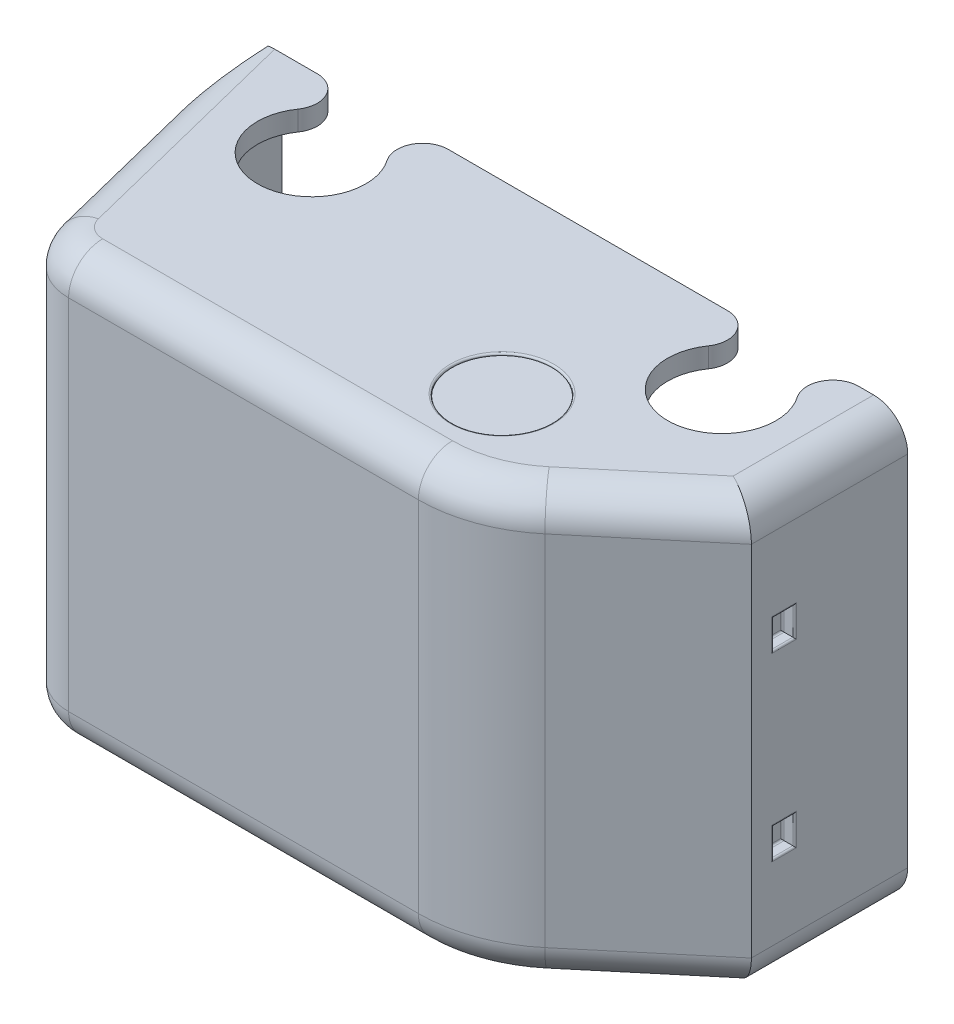
from build123d import *

# Parameters (mm, degrees)
BOSS_EXTRUDE1_DEPTH      = 70
BOSS_EXTRUDE1_DEPTH_BACK = 30
SKETCH1_W                = 225
SKETCH1_H                = 150
CUT_EXTRUDE1_DEPTH       = 280.329554469
CUT_EXTRUDE2_DEPTH       = 68
CUT_EXTRUDE2_DEPTH_BACK  = 68
SKETCH8_R                = 19.05
CUT_EXTRUDE3_DEPTH       = 185
FILLET1_R                = 12
FILLET2_R                = 50.8
FILLET3_R                = 19.05
SKETCH13_W               = 7.4
SKETCH13_H               = 9.9
CUT_EXTRUDE4_DEPTH       = 4.318
FILLET4_R                = 0.635
FILLET4_OF_MIRROR2_R     = 0.635
SKETCH14_R               = 17.5254
CUT_EXTRUDE5_DEPTH       = 0.75
FILLET5_R                = 0.635
FILLET6_R                = 0.635
SKETCH16_W               = 15.1
SKETCH16_H               = 10.1
CUT_EXTRUDE6_DEPTH       = 3.05


with BuildPart() as part:
    # Sketch1 → Boss-Extrude1 (new, two sides: drawn at the far end of the back side and taken through both)
    with BuildSketch(Plane.XY.offset(-BOSS_EXTRUDE1_DEPTH_BACK)):
        with Locations((112.5, 75)):
            Rectangle(SKETCH1_W, SKETCH1_H)
    extrude(amount=BOSS_EXTRUDE1_DEPTH + BOSS_EXTRUDE1_DEPTH_BACK)

    # Sketch2 → Cut-Extrude1 (cut, through all)
    with BuildSketch(Plane.XZ):
        Polygon((225, 70), (171.371088333, 70), (225, 25), align=None)
        Polygon((0, 70), (15, 70), (0, 10), align=None)
    extrude(amount=-CUT_EXTRUDE1_DEPTH, mode=Mode.SUBTRACT)

    # Sketch7 → Cut-Extrude2 (cut, two sides: drawn at the far end of the back side and taken through both)
    with BuildSketch(Plane(origin=(0, 75, 0), x_dir=(1, 0, 0), z_dir=(0, 1, 0)).offset(-CUT_EXTRUDE2_DEPTH_BACK)):
        Polygon((215, 30.615528128), (215, -26.863959865), (169.551237162, -65), (18.903882032, -65), (5, -9.384471872), (5, 30.615528128), align=None)
    extrude(amount=CUT_EXTRUDE2_DEPTH + CUT_EXTRUDE2_DEPTH_BACK, mode=Mode.SUBTRACT)

    # Sketch8 → Cut-Extrude3 (cut)
    with BuildSketch(Plane.XZ):
        with Locations((40.375, -5)):
            Circle(SKETCH8_R)
        with BuildLine():
            Line((17.33584854, -30), (63.41415146, -30))
            ThreePointArc((63.41415146, -30), (55.439090064, -25.17113842), (56.02191035, -15.86631016))
            ThreePointArc((56.02191035, -15.86631016), (40.375, -24.05), (24.72808965, -15.86631016))
            ThreePointArc((24.72808965, -15.86631016), (25.310909936, -25.17113842), (17.33584854, -30))
        make_face()
        with Locations((184.625, -5)):
            Circle(SKETCH8_R)
        with BuildLine():
            ThreePointArc((200.27191035, -15.86631016), (184.625, -24.05), (168.97808965, -15.86631016))
            ThreePointArc((168.97808965, -15.86631016), (169.560909936, -25.17113842), (161.58584854, -30))
            Line((161.58584854, -30), (207.66415146, -30))
            ThreePointArc((207.66415146, -30), (199.689090064, -25.17113842), (200.27191035, -15.86631016))
        make_face()
    extrude(amount=-CUT_EXTRUDE3_DEPTH, mode=Mode.SUBTRACT)

    # Fillet1
    fillet1_edges = [part.edges().sort_by_distance(p)[0] for p in [
        (198.185544167, 0, 47.5),
        (225, 0, -2.5),
        (7.5, 0, 40),
        (93.185544167, 0, 70),
        (7.5, 150, 40),
        (93.185544167, 150, 70),
        (198.185544167, 150, 47.5),
        (225, 150, -2.5),
    ]]
    fillet(fillet1_edges, radius=FILLET1_R)

    # Fillet2
    # the kernel refuses this fillet: 50.8 mm, written as the material it takes off along each edge
    with BuildSketch(Plane(origin=(152.881400433, 150, 19.2), x_dir=(0, 0, 1), z_dir=(-1, 0, 0))) as fillet2_piece_1:
        with BuildLine():
            CenterArc((38.8, -12), 12, 0, 90)
            Line((50.8, -12), (50.8, 0))
            Line((50.8, 0), (38.8, 0))
        make_face()
    revolve(axis=Axis((152.881400433, 150, 19.2), (0, 1, 0)), revolution_arc=40, mode=Mode.SUBTRACT)
    with BuildSketch(Plane(origin=(152.881400433, 0, 19.2), x_dir=(0.6427876096865435, 0, 0.7660444431189747), z_dir=(0.7660444431189747, 0, -0.6427876096865435))) as fillet2_piece_2:
        with BuildLine():
            CenterArc((38.8, -12), 12, 0, 90)
            Line((50.8, -12), (50.8, 0))
            Line((50.8, 0), (38.8, 0))
        make_face()
    revolve(axis=Axis((152.881400433, 0, 19.2), (0, -1, 0)), revolution_arc=40, mode=Mode.SUBTRACT)
    with BuildSketch(Plane(origin=(171.371088333, 0, 70), x_dir=(-1, 0, 0), z_dir=(0, 1, 0))) as fillet2_piece_3:
        with BuildLine():
            CenterArc((FILLET2_R * 0.363970234266, -FILLET2_R), FILLET2_R, 90, 40)
            Line((-FILLET2_R * 0.27881737542, -FILLET2_R * 0.233955556881), (0, 0))
            Line((0, 0), (FILLET2_R * 0.363970234266, 0))
        make_face()
    extrude(amount=150, mode=Mode.SUBTRACT)

    # Fillet3
    # the kernel refuses this fillet: 19.05 mm, written as the material it takes off along each edge
    with BuildSketch(Plane(origin=(29.873790542, 150, 50.95), x_dir=(-0.9701425001453319, 0, 0.24253562503633305), z_dir=(-0.24253562503633305, 0, -0.9701425001453319))) as fillet3_piece_1:
        with BuildLine():
            CenterArc((7.05, -12), 12, 0, 90)
            Line((19.05, -12), (19.05, 0))
            Line((19.05, 0), (7.05, 0))
        make_face()
    fillet3_piece_1_solid = revolve(axis=Axis((29.873790542, 150, 50.95), (0, 1, 0)), revolution_arc=75.963756532, mode=Mode.PRIVATE)
    with BuildSketch(Plane(origin=(29.873790542, 0, 50.95), x_dir=(0, 0, 1), z_dir=(1, 0, 0))) as fillet3_piece_2:
        with BuildLine():
            CenterArc((7.05, -12), 12, 0, 90)
            Line((19.05, -12), (19.05, 0))
            Line((19.05, 0), (7.05, 0))
        make_face()
    fillet3_piece_2_solid = revolve(axis=Axis((29.873790542, 0, 50.95), (0, -1, 0)), revolution_arc=75.963756532, mode=Mode.PRIVATE)
    with BuildSketch(Plane(origin=(15, 0, 70), x_dir=(1, 0, 0), z_dir=(0, 1, 0))) as fillet3_piece_3:
        with BuildLine():
            CenterArc((FILLET3_R * 0.780776406404, FILLET3_R), FILLET3_R, 194.036243468, 75.963756532)
            Line((-FILLET3_R * 0.189366093741, FILLET3_R * 0.757464374964), (0, 0))
            Line((0, 0), (FILLET3_R * 0.780776406404, 0))
        make_face()
    fillet3_piece_3_solid = extrude(amount=150, mode=Mode.PRIVATE)
    add([fillet3_piece_1_solid, fillet3_piece_2_solid, fillet3_piece_3_solid], mode=Mode.SUBTRACT)

    # Sketch13 → Cut-Extrude4 (cut)
    with BuildSketch(Plane(origin=(225, 0, 0), x_dir=(0, 0, -1), z_dir=(1, 0, 0))):
        with Locations((-13.5, 43.25)):
            Rectangle(SKETCH13_W, SKETCH13_H)
    cut_extrude4 = extrude(amount=-CUT_EXTRUDE4_DEPTH, mode=Mode.SUBTRACT)

    # Fillet4
    fillet4_edges = [part.edges().sort_by_distance(p)[0] for p in [
        (220.682, 43.25, 9.8),
        (220.682, 38.3, 13.5),
        (220.682, 43.25, 17.2),
        (220.682, 48.2, 13.5),
        (225, 43.25, 9.8),
        (225, 48.2, 13.5),
        (225, 43.25, 17.2),
        (225, 38.3, 13.5),
    ]]
    fillet(fillet4_edges, radius=FILLET4_R)

    # Mirror2: Cut-Extrude4 across plane
    add(cut_extrude4.mirror(Plane.ZX.offset(75)), mode=Mode.SUBTRACT)

    # Fillet4 of Mirror2
    fillet4_of_mirror2_edges = [part.edges().sort_by_distance(p)[0] for p in [
        (220.682, 106.75, 9.8),
        (220.682, 111.7, 13.5),
        (220.682, 106.75, 17.2),
        (220.682, 101.8, 13.5),
        (225, 106.75, 9.8),
        (225, 101.8, 13.5),
        (225, 106.75, 17.2),
        (225, 111.7, 13.5),
    ]]
    fillet(fillet4_of_mirror2_edges, radius=FILLET4_OF_MIRROR2_R)

    # Sketch14 → Cut-Extrude5 (cut)
    with BuildSketch(Plane.XZ):
        with Locations(Location((147.32, 35, 0), (0, 0, 270))):
            Circle(SKETCH14_R)
    cut_extrude5 = extrude(amount=-CUT_EXTRUDE5_DEPTH, mode=Mode.SUBTRACT)

    # Fillet5
    fillet5_edges = [part.edges().sort_by_distance(p)[0] for p in [
        (147.32, 0, 52.5254),
    ]]
    fillet(fillet5_edges, radius=FILLET5_R)

    # Mirror4: Cut-Extrude5 across plane
    add(cut_extrude5.mirror(Plane.ZX.offset(75)), mode=Mode.SUBTRACT)

    # Fillet6
    fillet6_edges = [part.edges().sort_by_distance(p)[0] for p in [
        (147.32, 150, 52.5254),
    ]]
    fillet(fillet6_edges, radius=FILLET6_R)

    # Sketch16 → Cut-Extrude6 (cut)
    with BuildSketch(Plane(origin=(-2.352941176, 0, 0.588235294), x_dir=(0.24253562503633294, 0, 0.9701425001453319), z_dir=(-0.9701425001453319, 0, 0.24253562503633294))):
        with Locations((27.752024594, 112.5)):
            Rectangle(SKETCH16_W, SKETCH16_H)
    cut_extrude6 = extrude(amount=-CUT_EXTRUDE6_DEPTH, mode=Mode.SUBTRACT)

    # Mirror5: Cut-Extrude6 across plane
    add(cut_extrude6.mirror(Plane.ZX.offset(75)), mode=Mode.SUBTRACT)


solid = part.part
